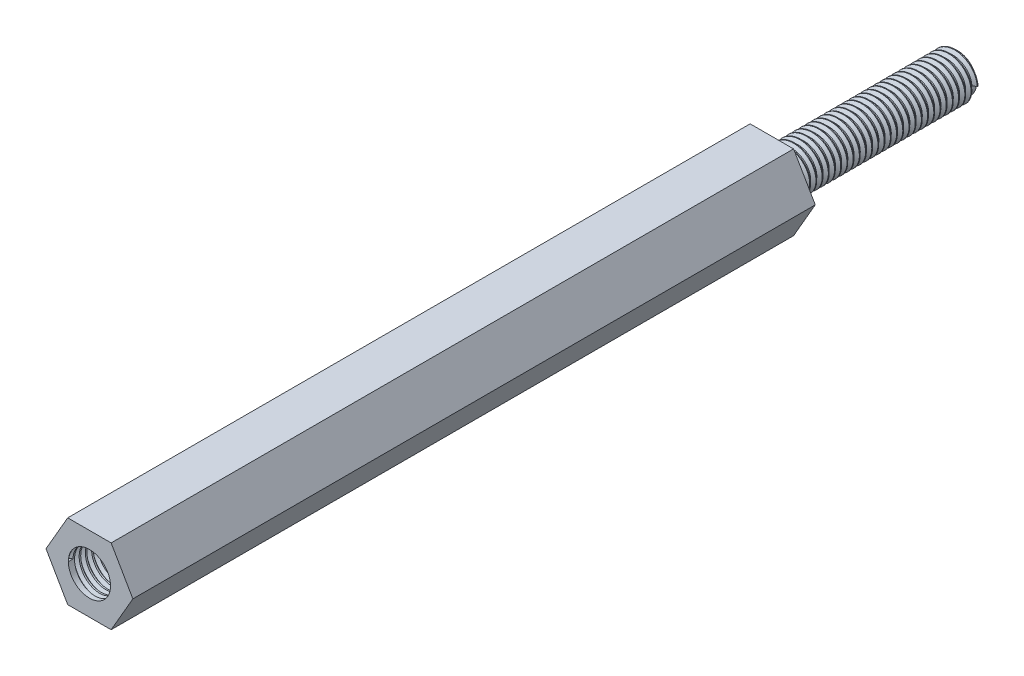
from build123d import *

# Parameters (mm, degrees)
BOSS_EXTRU_1_DEPTH      = 70
D_GAGEMENT_M31_D        = 3.4
D_GAGEMENT_M31_DEPTH    = 8
D_GAGEMENT_M31_TIP      = 1.021463052
FILETAGE1_PITCH         = 0.5
ESQUISSE12_R            = 1.5
ENL_V_MAT_EXTRU_1_DEPTH = 15
FILETAGE2_PITCH         = 0.5


with BuildPart() as part:
    # Esquisse1 → Boss.-Extru.1 (new body)
    with BuildSketch(Plane.XY):
        Polygon((5.25, 0.468911087), (7, 3.5), (5.25, 6.531088913), (1.75, 6.531088913), (0, 3.5), (1.75, 0.468911087), align=None)
    extrude(amount=BOSS_EXTRU_1_DEPTH)

    # Dégagement M31
    with Locations(Plane.XY.offset(70)):
        with Locations((3.5, 3.5)):
            Hole(D_GAGEMENT_M31_D / 2, depth=D_GAGEMENT_M31_DEPTH)
            with Locations((0, 0, -(D_GAGEMENT_M31_DEPTH + D_GAGEMENT_M31_TIP / 2))):  # 118° drill point
                Cone(0, D_GAGEMENT_M31_D / 2, D_GAGEMENT_M31_TIP, mode=Mode.SUBTRACT)

    # Filetage1: the profile of Profil de filetage1 profile screwed along a right-hand helix of 20 turns, 6 arcs to a turn; built about Z, then put on its axis
    filetage1_z = Axis((0, 0, 0), (0, 0, 1))
    filetage1_corners = [(1.6997, 0, -0.000173205), (1.970632937, 0, 0.156249999), (1.970632937, 0, 0.218749999), (1.6997, 0, 0.375173204)]
    with BuildLine(mode=Mode.PRIVATE) as filetage1_profile:
        Line(filetage1_corners[0], filetage1_corners[1])
        Line(filetage1_corners[1], filetage1_corners[2])
        Line(filetage1_corners[2], filetage1_corners[3])
        Line(filetage1_corners[3], filetage1_corners[0])
    filetage1_cap = Face(filetage1_profile.wire())
    filetage1_turn_angles = [0, 30, 60, 90, 120, 150, 180, 210, 240, 270, 300, 330, 360]
    filetage1_turn_weights = [1, 0.8660254037844387, 1, 0.8660254037844387, 1, 0.8660254037844387, 1, 0.8660254037844387, 1, 0.8660254037844387, 1, 0.8660254037844387, 1]
    filetage1_turn_rails = [Edge.make_bspline([Vector(p[0], p[1], 0).rotate(filetage1_z, filetage1_turn_angles[k]) / filetage1_turn_weights[k] + Vector(0, 0, p[2] + FILETAGE1_PITCH * filetage1_turn_angles[k] / 360) for k in range(13)], [0, 0, 0, 1, 1, 2, 2, 3, 3, 4, 4, 5, 5, 6, 6, 6], 2, filetage1_turn_weights) for p in filetage1_corners]
    filetage1_turn_sides = [Face.make_surface_from_curves(filetage1_turn_rails[p[0]], filetage1_turn_rails[p[1]]) for p in [(0, 1), (1, 2), (2, 3), (3, 0)]]
    filetage1 = Plane(origin=(3.5, 3.5, 70), x_dir=(-1, 0, 0), z_dir=(0, 0, -1)) * Solid(Shell([*[p.moved(Location((0, 0, FILETAGE1_PITCH * i))) for i in range(20) for p in filetage1_turn_sides], filetage1_cap, filetage1_cap.rotate(filetage1_z, 7200).moved(Location((0, 0, FILETAGE1_PITCH * 7200 / 360)))]))
    add(filetage1, mode=Mode.SUBTRACT)

    # Esquisse12 → Enlèv. mat.-Extru.1 (cut)
    with BuildSketch(Plane(origin=(0, 0, 0), x_dir=(-1, 0, 0), z_dir=(0, 0, -1))):
        Polygon((-5.25, 0.468911087), (-1.75, 0.468911087), (0, 3.5), (-1.75, 6.531088913), (-5.25, 6.531088913), (-7, 3.5), align=None)
        with Locations((-3.5, 3.5)):
            Circle(ESQUISSE12_R, mode=Mode.SUBTRACT)
    extrude(amount=-ENL_V_MAT_EXTRU_1_DEPTH, mode=Mode.SUBTRACT)

    # Filetage2: the profile of Profil de filetage2 profile screwed along a right-hand helix of 30 turns, 6 arcs to a turn; built about Z, then put on its axis
    filetage2_z = Axis((0, 0, 0), (0, 0, 1))
    filetage2_corners = [(1.4997, 0, -0.000173205), (1.770632938, 0, 0.156249999), (1.770632938, 0, 0.218749999), (1.4997, 0, 0.375173204)]
    with BuildLine(mode=Mode.PRIVATE) as filetage2_profile:
        Line(filetage2_corners[0], filetage2_corners[1])
        Line(filetage2_corners[1], filetage2_corners[2])
        Line(filetage2_corners[2], filetage2_corners[3])
        Line(filetage2_corners[3], filetage2_corners[0])
    filetage2_cap = Face(filetage2_profile.wire())
    filetage2_turn_angles = [0, 30, 60, 90, 120, 150, 180, 210, 240, 270, 300, 330, 360]
    filetage2_turn_weights = [1, 0.8660254037844387, 1, 0.8660254037844387, 1, 0.8660254037844387, 1, 0.8660254037844387, 1, 0.8660254037844387, 1, 0.8660254037844387, 1]
    filetage2_turn_rails = [Edge.make_bspline([Vector(p[0], p[1], 0).rotate(filetage2_z, filetage2_turn_angles[k]) / filetage2_turn_weights[k] + Vector(0, 0, p[2] + FILETAGE2_PITCH * filetage2_turn_angles[k] / 360) for k in range(13)], [0, 0, 0, 1, 1, 2, 2, 3, 3, 4, 4, 5, 5, 6, 6, 6], 2, filetage2_turn_weights) for p in filetage2_corners]
    filetage2_turn_sides = [Face.make_surface_from_curves(filetage2_turn_rails[p[0]], filetage2_turn_rails[p[1]]) for p in [(0, 1), (1, 2), (2, 3), (3, 0)]]
    filetage2 = Plane(origin=(3.5, 3.5, 0), x_dir=(1, 0, 0), z_dir=(0, 0, 1)) * Solid(Shell([*[p.moved(Location((0, 0, FILETAGE2_PITCH * i))) for i in range(30) for p in filetage2_turn_sides], filetage2_cap, filetage2_cap.rotate(filetage2_z, 10800).moved(Location((0, 0, FILETAGE2_PITCH * 10800 / 360)))]))
    add(filetage2)


solid = part.part
